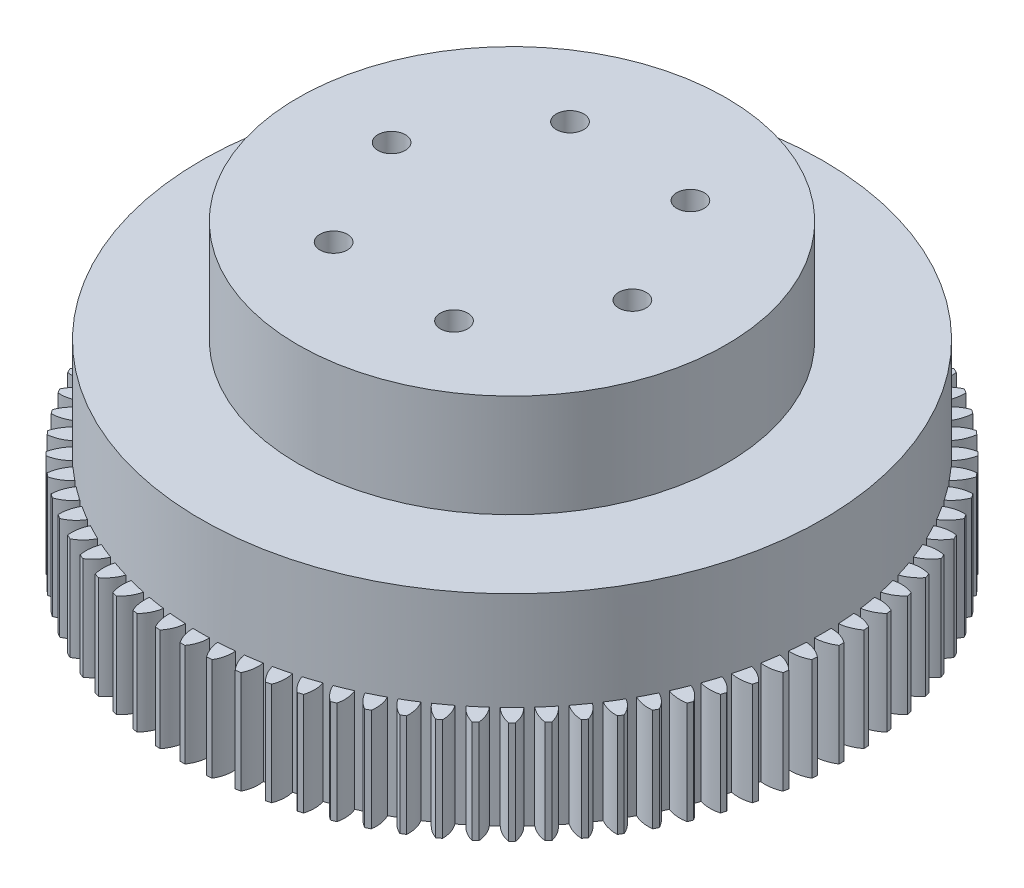
from build123d import *

# Parameters (mm, degrees)
SKETCH1_R           = 25
BOSS_EXTRUDE4_DEPTH = 12
SKETCH16_R          = 36.3
BOSS_EXTRUDE5_DEPTH = 23.5
BOSS_EXTRUDE6_DEPTH = 12
CIRPATTERN1_COUNT   = 80
SKETCH18_R          = 1.6
CUT_EXTRUDE1_DEPTH  = 65.974385722
SKETCH19_R          = 4
CUT_EXTRUDE2_DEPTH  = 32


with BuildPart() as part:
    # Sketch1 → Boss-Extrude4 (new body)
    with BuildSketch(Plane(origin=(0, 0, 0), x_dir=(1, 0, 0), z_dir=(0, 1, 0))):
        Circle(SKETCH1_R)
    extrude(amount=BOSS_EXTRUDE4_DEPTH)

    # Sketch16 → Boss-Extrude5 (add)
    with BuildSketch(Plane.XZ):
        Circle(SKETCH16_R)
    extrude(amount=BOSS_EXTRUDE5_DEPTH)

    # Sketch17 → Boss-Extrude6 (add)
    with BuildSketch(Plane.XZ.offset(23.5)):
        with BuildLine():
            Line((-0.292488982, 38.48), (0.292653692, 38.48))
            ThreePointArc((0.292653692, 38.48), (0.82217243, 37.39417865), (0.972653692, 36.195532127))
            ThreePointArc((0.972653692, 36.195532127), (0.000125792, 36.216676864), (-0.972488982, 36.2))
            ThreePointArc((-0.972488982, 36.2), (-0.79886792, 37.389621789), (-0.292488982, 38.48))
        make_face()
    boss_extrude6 = extrude(amount=-BOSS_EXTRUDE6_DEPTH)

    # CirPattern1: Boss-Extrude6 ×80 about axis
    cirpattern1_axis = Axis((0, -23.5, 0), (0, 1, 0))
    for i in range(1, CIRPATTERN1_COUNT):
        add(boss_extrude6.rotate(cirpattern1_axis, i * 360 / CIRPATTERN1_COUNT))

    # Sketch18 → Cut-Extrude1 (cut, through all)
    with BuildSketch(Plane(origin=(0, 12, 0), x_dir=(1, 0, 0), z_dir=(0, 1, 0))):
        with Locations((-15, 0.939827739)):
            Circle(SKETCH18_R)
        with Locations((-6.686085303, 13.460294926)):
            Circle(SKETCH18_R)
        with Locations((8.313914697, 12.520467187)):
            Circle(SKETCH18_R)
        with Locations((15, -0.939827739)):
            Circle(SKETCH18_R)
        with Locations((6.686085303, -13.460294926)):
            Circle(SKETCH18_R)
        with Locations((-8.313914697, -12.520467187)):
            Circle(SKETCH18_R)
    extrude(amount=-CUT_EXTRUDE1_DEPTH, mode=Mode.SUBTRACT)

    # Sketch19 → Cut-Extrude2 (cut)
    with BuildSketch(Plane.XZ.offset(23.5)):
        with Locations((15, 0.939827739)):
            Circle(SKETCH19_R)
        with Locations((8.313914697, -12.520467187)):
            Circle(SKETCH19_R)
        with Locations((-6.686085303, -13.460294926)):
            Circle(SKETCH19_R)
        with Locations((-15, -0.939827739)):
            Circle(SKETCH19_R)
        with Locations((-8.313914697, 12.520467187)):
            Circle(SKETCH19_R)
        with Locations((6.686085303, 13.460294926)):
            Circle(SKETCH19_R)
    extrude(amount=-CUT_EXTRUDE2_DEPTH, mode=Mode.SUBTRACT)


solid = part.part
